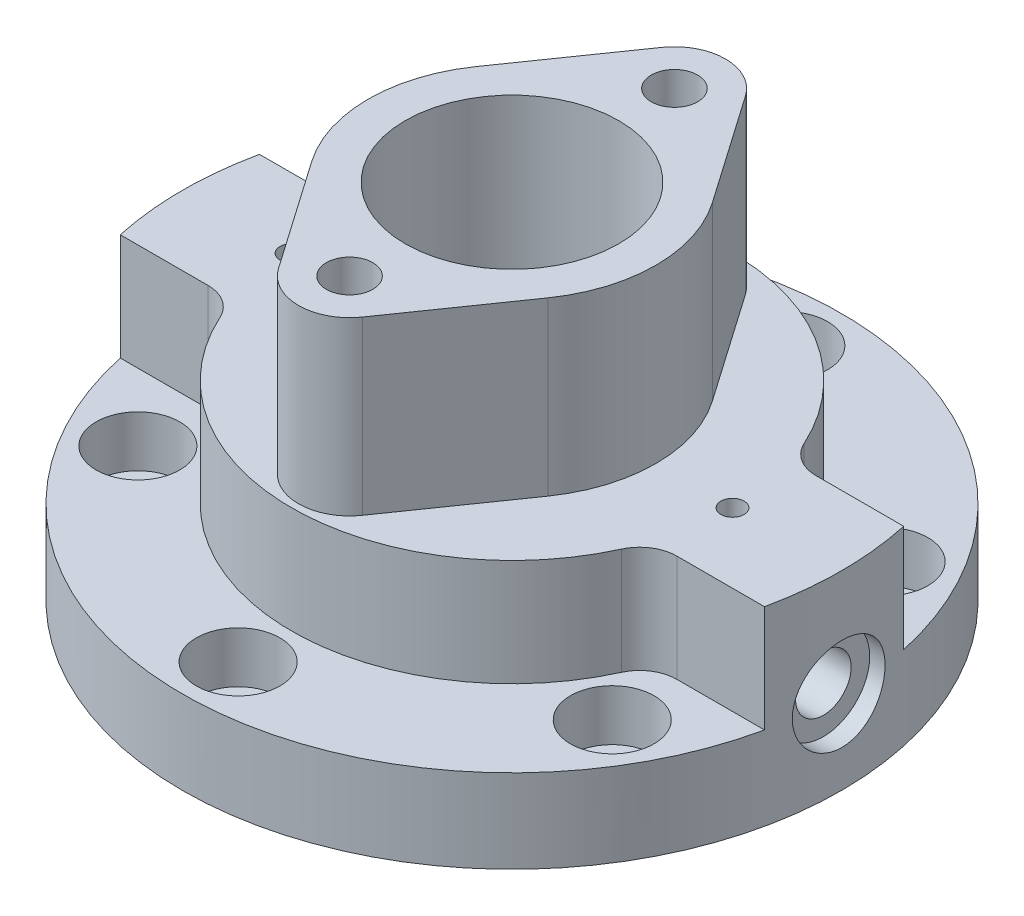
from build123d import *

# Parameters (mm, degrees)
SKETCH1_R                               = 71
BOSS_EXTRUDE1_DEPTH                     = 18
BOSS_EXTRUDE2_DEPTH                     = 23
BOSS_EXTRUDE3_DEPTH                     = 37
CBORE_FOR_M5_HEX_HEAD_BOLT1_D           = 11
CBORE_FOR_M5_HEX_HEAD_BOLT1_CBORE_D     = 18
CBORE_FOR_M5_HEX_HEAD_BOLT1_CBORE_DEPTH = 11
CIRPATTERN1_COUNT                       = 6
F_10_0MM_DOWEL_HOLE1_D                  = 10
F_10_0MM_DOWEL_HOLE1_DEPTH              = 15
F_10_0MM_DOWEL_HOLE1_TIP                = 3.004303095
MIRROR2_OUTLINE_W                       = 2.5
MIRROR2_OUTLINE_H                       = 12.566951185
CUT_EXTRUDE1_REACH                      = 110.457
SKETCH17_R                              = 2.5


# Read off the part's stored shape, not the designer's step: Mirror2
with BuildPart() as part:
    # Sketch1 → Boss-Extrude1 (new body)
    with BuildSketch(Plane(origin=(0, 0, 0), x_dir=(1, 0, 0), z_dir=(0, 1, 0))):
        with Locations(Location((0, 0, 0), (0, 0, 270))):
            Circle(SKETCH1_R)
    extrude(amount=BOSS_EXTRUDE1_DEPTH)

    # Sketch2 → Boss-Extrude2 (add)
    with BuildSketch(Plane(origin=(0, 18, 0), x_dir=(1, 0, 0), z_dir=(0, 1, 0))):
        with BuildLine():
            Line((-50.50990002, 15), (-69.397406292, 15))
            ThreePointArc((-69.397406292, 15), (-71, 0), (-69.397406292, -15))
            Line((-69.397406292, -15), (-50.50990002, -15))
            ThreePointArc((-50.50990002, -15), (-46.181073535, -16.272350986), (-43.229193711, -19.684684685))
            ThreePointArc((-43.229193711, -19.684684685), (0, -47.5), (43.229193711, -19.684684685))
            ThreePointArc((43.229193711, -19.684684685), (46.181073535, -16.272350986), (50.50990002, -15))
            Line((50.50990002, -15), (69.397406292, -15))
            ThreePointArc((69.397406292, -15), (71, 0), (69.397406292, 15))
            Line((69.397406292, 15), (50.50990002, 15))
            ThreePointArc((50.50990002, 15), (46.181073535, 16.272350986), (43.229193711, 19.684684685))
            ThreePointArc((43.229193711, 19.684684685), (0, 47.5), (-43.229193711, 19.684684685))
            ThreePointArc((-43.229193711, 19.684684685), (-46.181073535, 16.272350986), (-50.50990002, 15))
        make_face()
    extrude(amount=BOSS_EXTRUDE2_DEPTH)

    # Sketch3 → Boss-Extrude3 (add)
    with BuildSketch(Plane(origin=(0, 41, 0), x_dir=(1, 0, 0), z_dir=(0, 1, 0))):
        with BuildLine():
            Line((9.027169873, -41.285714286), (25.440206006, -17.714285714))
            ThreePointArc((25.440206006, -17.714285714), (31, 0), (25.440206006, 17.714285714))
            Line((25.440206006, 17.714285714), (9.027169873, 41.285714286))
            ThreePointArc((9.027169873, 41.285714286), (0, 46), (-9.027169873, 41.285714286))
            Line((-9.027169873, 41.285714286), (-25.440206006, 17.714285714))
            ThreePointArc((-25.440206006, 17.714285714), (-31, 0), (-25.440206006, -17.714285714))
            Line((-25.440206006, -17.714285714), (-9.027169873, -41.285714286))
            ThreePointArc((-9.027169873, -41.285714286), (0, -46), (9.027169873, -41.285714286))
        make_face()
    extrude(amount=BOSS_EXTRUDE3_DEPTH)

    # CBORE for M5 Hex Head Bolt1 (through all)
    with Locations(Plane(origin=(0, 18, 59), x_dir=(0, 0, 1), z_dir=(0, 1, 0))):
        with Locations((0, 0)):
            cbore_for_m5_hex_head_bolt1 = CounterBoreHole(CBORE_FOR_M5_HEX_HEAD_BOLT1_D / 2, CBORE_FOR_M5_HEX_HEAD_BOLT1_CBORE_D / 2, CBORE_FOR_M5_HEX_HEAD_BOLT1_CBORE_DEPTH)

    # CirPattern1: CBORE for M5 Hex Head Bolt1 ×6 about axis
    cirpattern1_axis = Axis((0, 0, 0), (0, 1, 0))
    for i in range(1, CIRPATTERN1_COUNT):
        add(cbore_for_m5_hex_head_bolt1.rotate(cirpattern1_axis, i * 360 / CIRPATTERN1_COUNT), mode=Mode.SUBTRACT)

    # Ø10.0mm Dowel Hole1
    with Locations(Plane(origin=(0, 78, -35), x_dir=(0, 0, 1), z_dir=(0, 1, 0))):
        with Locations((0, 0), (70, 0)):
            Hole(F_10_0MM_DOWEL_HOLE1_D / 2, depth=F_10_0MM_DOWEL_HOLE1_DEPTH)
            with Locations((0, 0, -(F_10_0MM_DOWEL_HOLE1_DEPTH + F_10_0MM_DOWEL_HOLE1_TIP / 2))):  # 118° drill point
                Cone(0, F_10_0MM_DOWEL_HOLE1_D / 2, F_10_0MM_DOWEL_HOLE1_TIP, mode=Mode.SUBTRACT)

    # Sketch12 → Cut-Revolve3 (revolve, cut)
    with BuildSketch(Plane(origin=(0, 0, 0), x_dir=(0, 0, -1), z_dir=(1, 0, 0))):
        with BuildLine():
            Line((0, 0), (31, 0))
            Line((31, 0), (31, 18))
            Line((31, 18), (25, 18))
            Line((25, 18), (22.043106659, 29.03527618))
            ThreePointArc((22.043106659, 29.03527618), (20.61444907, 31.173413361), (18.179403354, 32))
            Line((18.179403354, 32), (11.248711306, 32))
            Line((11.248711306, 32), (11.248711306, 41))
            Line((11.248711306, 41), (23, 41))
            Line((23, 41), (23, 78))
            Line((23, 78), (0, 78))
            Line((0, 78), (0, 0))
        make_face()
    revolve(axis=Axis((0, 0, 0), (0, 1, 0)), mode=Mode.SUBTRACT)

    # Sketch13 → CBORE for M5 Hex Head Bolt2 (revolve, cut)
    with BuildSketch(Plane(origin=(-70.999948097, 18, -0.085850351), x_dir=(-0.001209159868286979, 0, 0.9999992689659393), z_dir=(0, 1, 0))):
        Polygon((0, 0), (0, 35.605163714), (6, 32), (6, 4), (10, 4), (10, 0), align=None)
    cbore_for_m5_hex_head_bolt2 = revolve(axis=Axis((-77.349943455, 18, -0.093528516), (0.9999992689659393, 0, 0.001209159868286979)), mode=Mode.SUBTRACT)

    # Mirror1: CBORE for M5 Hex Head Bolt2 across plane
    add(cbore_for_m5_hex_head_bolt2.mirror(Plane(origin=(0, 0, 0), x_dir=(0, 0, 1), z_dir=(1, 0, 0))), mode=Mode.SUBTRACT)

    # Sketch16 → Ø5.0mm Dowel Hole1 (revolve, cut)
    with BuildSketch(Plane(origin=(-70.999948097, 18, -0.085850351), x_dir=(-0.001209159868286979, 0, 0.9999992689659393), z_dir=(0, 1, 0))):
        Polygon((0, 0), (0, 72.501151548), (2.5, 70.999), (2.5, 0), align=None)
    revolve(axis=Axis((-77.349943455, 18, -0.093528516), (0.9999992689659393, 0, 0.001209159868286979)), mode=Mode.SUBTRACT)

    # Mirror2 outline → Mirror2 (revolve, cut)
    with BuildSketch(Plane(origin=(0, 18, 0), x_dir=(0, 1, 0), z_dir=(-0.0012091598682869803, 0, -0.9999992689659393))):
        with Locations((1.25, 30.613512241)):
            Rectangle(MIRROR2_OUTLINE_W, MIRROR2_OUTLINE_H)
        Polygon((2.5, -25.031211929), (2.5, -24.330096403), (2.439383393, -24.330096403), (2.439383393, -25.067634061), align=None)
    revolve(axis=Axis((0, 18, 0), (0.9999992689659393, 0, -0.0012091598682869803)), mode=Mode.SUBTRACT)

    # Sketch17 → Cut-Extrude1 (cut, up to next)
    with BuildSketch(Plane(origin=(0, 41, 0), x_dir=(1, 0, 0), z_dir=(0, 1, 0)), mode=Mode.PRIVATE) as cut_extrude1_sk1:
        with Locations(Location((-47.5, 0, 0), (0, 0, 270))):
            Circle(SKETCH17_R)
    cut_extrude1_tool1 = extrude(cut_extrude1_sk1.sketch, amount=-CUT_EXTRUDE1_REACH, mode=Mode.PRIVATE) & part.part
    # Sketch17 → Cut-Extrude1 (cut, up to next)
    with BuildSketch(Plane(origin=(0, 41, 0), x_dir=(1, 0, 0), z_dir=(0, 1, 0)), mode=Mode.PRIVATE) as cut_extrude1_sk2:
        with Locations(Location((47.5, 0, 0), (0, 0, 270))):
            Circle(SKETCH17_R)
    cut_extrude1_tool2 = extrude(cut_extrude1_sk2.sketch, amount=-CUT_EXTRUDE1_REACH, mode=Mode.PRIVATE) & part.part
    add(cut_extrude1_tool1.solids().sort_by_distance((-47.5, 41, 0))[0], mode=Mode.SUBTRACT)
    add(cut_extrude1_tool2.solids().sort_by_distance((47.5, 41, 0))[0], mode=Mode.SUBTRACT)


solid = part.part
